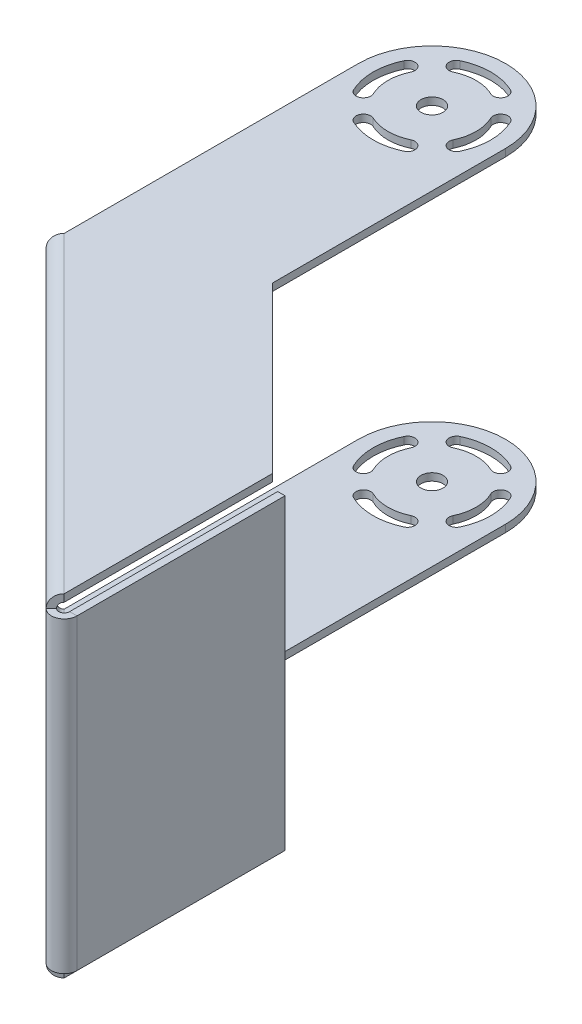
from build123d import *

# Parameters (mm, degrees)
SM_BASE_FLANGE_1_DEPTH      = 1
SM_EDGE_FLANGE_1_DEPTH      = 60
SM_EDGE_FLANGE_2_DEPTH      = 60
SM_START                    = 1
SM_EDGE_FLANGE_2_FLAT_DEPTH = 1
SKETCH_16_R                 = 1.5
CUT_EXTRUDE_1_DEPTH         = 75.818592891
FILLET_1_R                  = 10
SM_EDGE_FLANGE_4_DEPTH      = 41.7634
SM_EDGE_FLANGE_5_DEPTH      = 41.7634


# Sheet-metal steps are written as plain solids
with BuildPart() as part:
    # Sketch 1 → 基材-凸緣1 (new body)
    with BuildSketch(Plane(origin=(0, 0, 0), x_dir=(1, 0, 0), z_dir=(0, 1, 0))):
        Polygon((-10, 0), (32.426406871, -42.426406871), (32.426406871, -14.142135624), (10, 8.284271247), (10, 50), (-10, 50), align=None)
    extrude(amount=-SM_BASE_FLANGE_1_DEPTH)

    # 邊線-凸緣1 section (across the edge) → 邊線-凸緣1 (add)
    with BuildSketch(Plane(origin=(31.905552016, -1, 42.947261726), x_dir=(0.7071067811865475, -3.4914813388431334e-15, -0.7071067811865476), z_dir=(-0.7071067811865476, 0, -0.7071067811865475))):
        with BuildLine():
            Line((-1, 0.7366), (-1, 42.5))
            Line((-1, 42.5), (0, 42.5))
            Line((0, 42.5), (0, 0.7366))
            ThreePointArc((0, 0.7366), (0.215745145, 0.215745145), (0.7366, 0))
            Line((0.7366, 0), (0.7366, -1))
            ThreePointArc((0.7366, -1), (-0.491361636, -0.491361636), (-1, 0.7366))
        make_face()
    extrude(amount=SM_EDGE_FLANGE_1_DEPTH)

    # 邊線-凸緣2 bend section (across the edge) → 邊線-凸緣2 (add)
    with BuildSketch(Plane(origin=(31.905552016, -44.2366, 42.947261726), x_dir=(0, 1, 0), z_dir=(-0.7071067811865477, 0, -0.7071067811865475))):
        with BuildLine():
            Line((-1, 0.7366), (0, 0.7366))
            ThreePointArc((0, 0.7366), (0.215745145, 0.215745145), (0.7366, 0))
            Line((0.7366, 0), (0.7366, -1))
            ThreePointArc((0.7366, -1), (-0.491361636, -0.491361636), (-1, 0.7366))
        make_face()
    extrude(amount=SM_EDGE_FLANGE_2_DEPTH)

    # 邊線-凸緣2 profile (on flange) → 邊線-凸緣2 flat (add)
    with BuildSketch(Plane(origin=(-5.520854855, -44.2366, 5.520854855), x_dir=(-0.7071067811865477, 0, -0.7071067811865475), z_dir=(0, -1, 0)).offset(SM_START)):
        Polygon((7.071067812, 0.7366), (42.426406871, 36.091939059), (28.284271247, 50.234074683), (-1.213203436, 20.7366), (-32.928932188, 20.7366), (-52.928932188, 0.7366), align=None)
    extrude(amount=-SM_EDGE_FLANGE_2_FLAT_DEPTH)

    # 草圖16 → 除料-伸長1 (cut, through all)
    with BuildSketch(Plane(origin=(0, 0, 0), x_dir=(1, 0, 0), z_dir=(0, 1, 0))):
        with Locations(Location((0, 40, 0), (0, 0, 270))):
            Circle(SKETCH_16_R)
        with BuildLine():
            ThreePointArc((3.428571429, 47.228063223), (0, 48), (-3.428571429, 47.228063223))
            ThreePointArc((-3.428571429, 47.228063223), (-3.903507903, 45.895983892), (-2.571428571, 45.421047417))
            ThreePointArc((-2.571428571, 45.421047417), (0, 46), (2.571428571, 45.421047417))
            ThreePointArc((2.571428571, 45.421047417), (3.903507903, 45.895983892), (3.428571429, 47.228063223))
        make_face()
        with BuildLine():
            ThreePointArc((7.228063223, 36.571428571), (8, 40), (7.228063223, 43.428571429))
            ThreePointArc((7.228063223, 43.428571429), (5.895983892, 43.903507903), (5.421047417, 42.571428571))
            ThreePointArc((5.421047417, 42.571428571), (6, 40), (5.421047417, 37.428571429))
            ThreePointArc((5.421047417, 37.428571429), (5.895983892, 36.096492097), (7.228063223, 36.571428571))
        make_face()
        with BuildLine():
            ThreePointArc((-3.428571429, 32.771936777), (0, 32), (3.428571429, 32.771936777))
            ThreePointArc((3.428571429, 32.771936777), (3.903507903, 34.104016108), (2.571428571, 34.578952583))
            ThreePointArc((2.571428571, 34.578952583), (0, 34), (-2.571428571, 34.578952583))
            ThreePointArc((-2.571428571, 34.578952583), (-3.903507903, 34.104016108), (-3.428571429, 32.771936777))
        make_face()
        with BuildLine():
            ThreePointArc((-7.228063223, 43.428571429), (-8, 40), (-7.228063223, 36.571428571))
            ThreePointArc((-7.228063223, 36.571428571), (-5.895983892, 36.096492097), (-5.421047417, 37.428571429))
            ThreePointArc((-5.421047417, 37.428571429), (-6, 40), (-5.421047417, 42.571428571))
            ThreePointArc((-5.421047417, 42.571428571), (-5.895983892, 43.903507903), (-7.228063223, 43.428571429))
        make_face()
    extrude(amount=-CUT_EXTRUDE_1_DEPTH, mode=Mode.SUBTRACT)

    # 圓角1
    fillet_1_edges = [part.edges().sort_by_distance(p)[0] for p in [
        (-10, -0.5, -50),
        (10, -0.5, -50),
        (-10, -44.7366, -50),
        (10, -44.7366, -50),
    ]]
    fillet(fillet_1_edges, radius=FILLET_1_R - 0.0001)  # a hair under: the kernel refuses the full size

    # 邊線-凸緣4 section (across the edge) → 邊線-凸緣4 (add)
    with BuildSketch(Plane(origin=(33.163006871, -1.7366, 44.204716581), x_dir=(-1, 0, 0), z_dir=(0, -1, 0))):
        with BuildLine():
            Line((-1, 1.77830971), (-1, 30.062580958))
            Line((-1, 30.062580958), (0, 30.062580958))
            Line((0, 30.062580958), (0, 1.77830971))
            ThreePointArc((0, 1.77830971), (0.454715384, 1.097780046), (1.257454855, 1.257454855))
            Line((1.257454855, 1.257454855), (1.964561636, 0.550348074))
            ThreePointArc((1.964561636, 0.550348074), (0.072031951, 0.173900514), (-1, 1.77830971))
        make_face()
    extrude(amount=SM_EDGE_FLANGE_4_DEPTH)

    # 邊線-凸緣5 section (across the edge) → 邊線-凸緣5 (add)
    with BuildSketch(Plane(origin=(-10.7366, -43.5, 0.30510971), x_dir=(1, 0, 0), z_dir=(0, 1, 0))):
        with BuildLine():
            Line((-1, 0.30510971), (-1, 25))
            Line((-1, 25), (0, 25))
            Line((0, 25), (0, 0.30510971))
            ThreePointArc((0, 0.30510971), (0.056070336, 0.023225094), (0.215745145, -0.215745145))
            Line((0.215745145, -0.215745145), (-0.491361636, -0.922851926))
            ThreePointArc((-0.491361636, -0.922851926), (-0.867809196, -0.359458339), (-1, 0.30510971))
        make_face()
    extrude(amount=SM_EDGE_FLANGE_5_DEPTH)


solid = part.part
